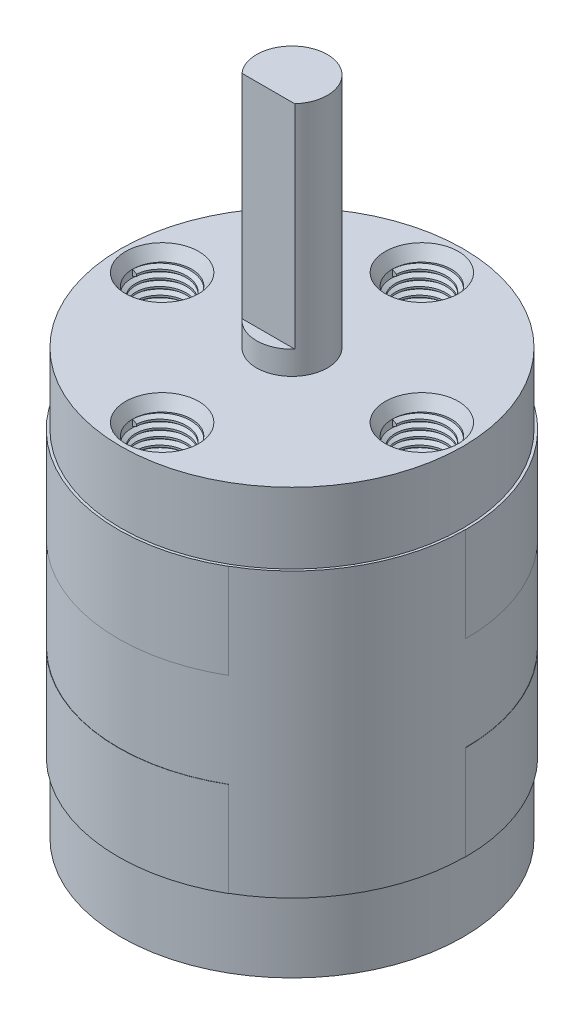
from build123d import *
from build123d.topology import SkipClean

# Parameters (mm, degrees)
SKETCH_1_R               = 7.25
EXTRUDE_1_DEPTH          = 18
SKETCH_2_R               = 1.5
EXTRUDE_2_DEPTH          = 10
CUT_EXTRUDE_START        = -9
CUT_EXTRUDE_1_DEPTH      = 9
SKETCH_4_R               = 1.25
CUT_EXTRUDE_2_DEPTH      = 5
PATTERN_CIRCULAR_1_COUNT = 4
SKETCH_9_W               = 0.1
SKETCH_9_H               = 12
SKETCH_11_W              = 0.01
SKETCH_11_H              = 4
REVOLVE_2_ANGLE          = 300
THREAD_1_PITCH           = 0.3175
THREAD_2_PITCH           = 0.3175
THREAD_3_PITCH           = 0.3175
THREAD_4_PITCH           = 0.3175


with BuildPart() as part:
    # Sketch 1 → 凸台-拉伸1 (new body)
    with BuildSketch(Plane(origin=(0, 0, 0), x_dir=(1, 0, 0), z_dir=(0, 1, 0))):
        with Locations(Location((0, 0, 0), (0, 0, 270))):
            Circle(SKETCH_1_R)
    extrude(amount=EXTRUDE_1_DEPTH)

    # Sketch 2 → 凸台-拉伸2 (add)
    with BuildSketch(Plane(origin=(0, 18, 0), x_dir=(1, 0, 0), z_dir=(0, 1, 0))):
        with Locations(Location((0, 0, 0), (0, 0, 270))):
            Circle(SKETCH_2_R)
    extrude(amount=EXTRUDE_2_DEPTH)

    # Sketch 3 → 切除-拉伸1 (cut)
    with BuildSketch(Plane(origin=(0, 28, 0), x_dir=(1, 0, 0), z_dir=(0, 1, 0)).offset(CUT_EXTRUDE_START)):
        with BuildLine():
            Line((1.118033989, -1), (-1.118033989, -1))
            ThreePointArc((-1.118033989, -1), (0, -1.5), (1.118033989, -1))
        make_face()
    extrude(amount=CUT_EXTRUDE_1_DEPTH, mode=Mode.SUBTRACT)

    # Sketch 4 → 切除-拉伸2 (cut)
    with BuildSketch(Plane(origin=(0, 18, 0), x_dir=(1, 0, 0), z_dir=(0, 1, 0))):
        with Locations(Location((5.5, 0, 0), (0, 0, 270))):
            Circle(SKETCH_4_R)
        with Locations(Location((0, -5.5, 0), (0, 0, 270))):
            Circle(SKETCH_4_R)
        with Locations(Location((-5.5, 0, 0), (0, 0, 270))):
            Circle(SKETCH_4_R)
        with Locations(Location((0, 5.5, 0), (0, 0, 270))):
            Circle(SKETCH_4_R)
    extrude(amount=-CUT_EXTRUDE_2_DEPTH, mode=Mode.SUBTRACT)

    # 草图8 → 切除-旋转1 (revolve, cut)
    with BuildSketch(Plane.XY, mode=Mode.PRIVATE) as cut_revolve_1_sk:
        Polygon((6.75, 18), (7.05, 18), (6.75, 17.5), (5.5, 17.5), (5.5, 18), align=None)
    cut_revolve_1 = revolve(cut_revolve_1_sk.sketch.rotate(Axis((5.5, 18, 0), (0, -1, 0)), 90), axis=Axis((5.5, 18, 0), (0, -1, 0)), mode=Mode.SUBTRACT)

    # 阵列(圆周)1: 切除-旋转1 ×4 about axis
    pattern_circular_1_axis = Axis((0, 0, 0), (0, 1, 0))
    for i in range(1, PATTERN_CIRCULAR_1_COUNT):
        add(cut_revolve_1.rotate(pattern_circular_1_axis, i * 360 / PATTERN_CIRCULAR_1_COUNT), mode=Mode.SUBTRACT)

    # 草图9 → 旋转1 (revolve)
    with BuildSketch(Plane.XY, mode=Mode.PRIVATE) as revolve_1_sk:
        with Locations((7.3, 9)):
            Rectangle(SKETCH_9_W, SKETCH_9_H)
    revolve(revolve_1_sk.sketch.rotate(Axis((0, 0, 0), (0, 1, 0)), 90), axis=Axis((0, 0, 0), (0, 1, 0)))

    # 草图11 → 旋转2 (revolve)
    with BuildSketch(Plane.XY):
        with Locations((7.355, 13)):
            Rectangle(SKETCH_11_W, SKETCH_11_H)
        with Locations((7.355, 5)):
            Rectangle(SKETCH_11_W, SKETCH_11_H)
    revolve(axis=Axis((0, 0, 0), (0, 1, 0)), revolution_arc=REVOLVE_2_ANGLE)

    # 螺纹线1: the profile of Sketch 1 2 profile screwed along a right-hand helix of 15.748031 turns, 6 arcs to a turn; built about Z, then put on its axis
    with SkipClean():  # the faces are left unmerged after this step: merging them gives an invalid solid
        thread_1_z = Axis((0, 0, 0), (0, 0, 1))
        thread_1_corners = [(1.2503, 0, -0.000173205), (1.2503, 0, 0.277985704), (1.078148085, 0, 0.17859375), (1.078148085, 0, 0.09921875)]
        with BuildLine(mode=Mode.PRIVATE) as thread_1_profile:
            Line(thread_1_corners[0], thread_1_corners[1])
            Line(thread_1_corners[1], thread_1_corners[2])
            Line(thread_1_corners[2], thread_1_corners[3])
            Line(thread_1_corners[3], thread_1_corners[0])
        thread_1_cap = Face(thread_1_profile.wire())
        thread_1_turn_angles = [0, 30, 60, 90, 120, 150, 180, 210, 240, 270, 300, 330, 360]
        thread_1_turn_weights = [1, 0.8660254037844387, 1, 0.8660254037844387, 1, 0.8660254037844387, 1, 0.8660254037844387, 1, 0.8660254037844387, 1, 0.8660254037844387, 1]
        thread_1_turn_rails = [Edge.make_bspline([Vector(p[0], p[1], 0).rotate(thread_1_z, thread_1_turn_angles[k]) / thread_1_turn_weights[k] + Vector(0, 0, p[2] + THREAD_1_PITCH * thread_1_turn_angles[k] / 360) for k in range(13)], [0, 0, 0, 1, 1, 2, 2, 3, 3, 4, 4, 5, 5, 6, 6, 6], 2, thread_1_turn_weights) for p in thread_1_corners]
        thread_1_turn_sides = [Face.make_surface_from_curves(thread_1_turn_rails[p[0]], thread_1_turn_rails[p[1]]) for p in [(0, 1), (1, 2), (2, 3), (3, 0)]]
        thread_1_last_angles = [5400, 5430, 5460, 5490, 5520, 5550, 5580, 5610, 5640, 5654.645669291, 5669.291338583]
        thread_1_last_weights = [1, 0.8660254037844387, 1, 0.8660254037844387, 1, 0.8660254037844387, 1, 0.8660254037844387, 1, 0.9675079437748935, 1]
        thread_1_last_rails = [Edge.make_bspline([Vector(p[0], p[1], 0).rotate(thread_1_z, thread_1_last_angles[k]) / thread_1_last_weights[k] + Vector(0, 0, p[2] + THREAD_1_PITCH * thread_1_last_angles[k] / 360) for k in range(11)], [0, 0, 0, 1, 1, 2, 2, 3, 3, 4, 4, 5, 5, 5], 2, thread_1_last_weights) for p in thread_1_corners]
        thread_1_last_sides = [Face.make_surface_from_curves(thread_1_last_rails[p[0]], thread_1_last_rails[p[1]]) for p in [(0, 1), (1, 2), (2, 3), (3, 0)]]
        thread_1 = Plane(origin=(-5.5, 17.5, 0), x_dir=(-1, 0, 0), z_dir=(0, -1, 0)) * Solid(Shell([*[p.moved(Location((0, 0, THREAD_1_PITCH * i))) for i in range(15) for p in thread_1_turn_sides], *thread_1_last_sides, thread_1_cap, thread_1_cap.rotate(thread_1_z, 5669.291338583).moved(Location((0, 0, THREAD_1_PITCH * 5669.291338583 / 360)))]))
        add(thread_1)

    # 螺纹线2: the profile of Sketch 2 2 profile screwed along a right-hand helix of 15.748031 turns, 6 arcs to a turn; built about Z, then put on its axis
    with SkipClean():  # the faces are left unmerged after this step: merging them gives an invalid solid
        thread_2_z = Axis((0, 0, 0), (0, 0, 1))
        thread_2_corners = [(1.2503, 0, -0.000173205), (1.2503, 0, 0.277985704), (1.078148085, 0, 0.17859375), (1.078148085, 0, 0.09921875)]
        with BuildLine(mode=Mode.PRIVATE) as thread_2_profile:
            Line(thread_2_corners[0], thread_2_corners[1])
            Line(thread_2_corners[1], thread_2_corners[2])
            Line(thread_2_corners[2], thread_2_corners[3])
            Line(thread_2_corners[3], thread_2_corners[0])
        thread_2_cap = Face(thread_2_profile.wire())
        thread_2_turn_angles = [0, 30, 60, 90, 120, 150, 180, 210, 240, 270, 300, 330, 360]
        thread_2_turn_weights = [1, 0.8660254037844387, 1, 0.8660254037844387, 1, 0.8660254037844387, 1, 0.8660254037844387, 1, 0.8660254037844387, 1, 0.8660254037844387, 1]
        thread_2_turn_rails = [Edge.make_bspline([Vector(p[0], p[1], 0).rotate(thread_2_z, thread_2_turn_angles[k]) / thread_2_turn_weights[k] + Vector(0, 0, p[2] + THREAD_2_PITCH * thread_2_turn_angles[k] / 360) for k in range(13)], [0, 0, 0, 1, 1, 2, 2, 3, 3, 4, 4, 5, 5, 6, 6, 6], 2, thread_2_turn_weights) for p in thread_2_corners]
        thread_2_turn_sides = [Face.make_surface_from_curves(thread_2_turn_rails[p[0]], thread_2_turn_rails[p[1]]) for p in [(0, 1), (1, 2), (2, 3), (3, 0)]]
        thread_2_last_angles = [5400, 5430, 5460, 5490, 5520, 5550, 5580, 5610, 5640, 5654.645669291, 5669.291338583]
        thread_2_last_weights = [1, 0.8660254037844387, 1, 0.8660254037844387, 1, 0.8660254037844387, 1, 0.8660254037844387, 1, 0.9675079437748935, 1]
        thread_2_last_rails = [Edge.make_bspline([Vector(p[0], p[1], 0).rotate(thread_2_z, thread_2_last_angles[k]) / thread_2_last_weights[k] + Vector(0, 0, p[2] + THREAD_2_PITCH * thread_2_last_angles[k] / 360) for k in range(11)], [0, 0, 0, 1, 1, 2, 2, 3, 3, 4, 4, 5, 5, 5], 2, thread_2_last_weights) for p in thread_2_corners]
        thread_2_last_sides = [Face.make_surface_from_curves(thread_2_last_rails[p[0]], thread_2_last_rails[p[1]]) for p in [(0, 1), (1, 2), (2, 3), (3, 0)]]
        thread_2 = Plane(origin=(0, 17.5, -5.5), x_dir=(-1, 0, 0), z_dir=(0, -1, 0)) * Solid(Shell([*[p.moved(Location((0, 0, THREAD_2_PITCH * i))) for i in range(15) for p in thread_2_turn_sides], *thread_2_last_sides, thread_2_cap, thread_2_cap.rotate(thread_2_z, 5669.291338583).moved(Location((0, 0, THREAD_2_PITCH * 5669.291338583 / 360)))]))
        add(thread_2)

    # 螺纹线3: the profile of Sketch 3 2 profile screwed along a right-hand helix of 15.748031 turns, 6 arcs to a turn; built about Z, then put on its axis
    with SkipClean():  # the faces are left unmerged after this step: merging them gives an invalid solid
        thread_3_z = Axis((0, 0, 0), (0, 0, 1))
        thread_3_corners = [(1.2503, 0, -0.000173205), (1.2503, 0, 0.277985704), (1.078148085, 0, 0.17859375), (1.078148085, 0, 0.09921875)]
        with BuildLine(mode=Mode.PRIVATE) as thread_3_profile:
            Line(thread_3_corners[0], thread_3_corners[1])
            Line(thread_3_corners[1], thread_3_corners[2])
            Line(thread_3_corners[2], thread_3_corners[3])
            Line(thread_3_corners[3], thread_3_corners[0])
        thread_3_cap = Face(thread_3_profile.wire())
        thread_3_turn_angles = [0, 30, 60, 90, 120, 150, 180, 210, 240, 270, 300, 330, 360]
        thread_3_turn_weights = [1, 0.8660254037844387, 1, 0.8660254037844387, 1, 0.8660254037844387, 1, 0.8660254037844387, 1, 0.8660254037844387, 1, 0.8660254037844387, 1]
        thread_3_turn_rails = [Edge.make_bspline([Vector(p[0], p[1], 0).rotate(thread_3_z, thread_3_turn_angles[k]) / thread_3_turn_weights[k] + Vector(0, 0, p[2] + THREAD_3_PITCH * thread_3_turn_angles[k] / 360) for k in range(13)], [0, 0, 0, 1, 1, 2, 2, 3, 3, 4, 4, 5, 5, 6, 6, 6], 2, thread_3_turn_weights) for p in thread_3_corners]
        thread_3_turn_sides = [Face.make_surface_from_curves(thread_3_turn_rails[p[0]], thread_3_turn_rails[p[1]]) for p in [(0, 1), (1, 2), (2, 3), (3, 0)]]
        thread_3_last_angles = [5400, 5430, 5460, 5490, 5520, 5550, 5580, 5610, 5640, 5654.645669291, 5669.291338583]
        thread_3_last_weights = [1, 0.8660254037844387, 1, 0.8660254037844387, 1, 0.8660254037844387, 1, 0.8660254037844387, 1, 0.9675079437748935, 1]
        thread_3_last_rails = [Edge.make_bspline([Vector(p[0], p[1], 0).rotate(thread_3_z, thread_3_last_angles[k]) / thread_3_last_weights[k] + Vector(0, 0, p[2] + THREAD_3_PITCH * thread_3_last_angles[k] / 360) for k in range(11)], [0, 0, 0, 1, 1, 2, 2, 3, 3, 4, 4, 5, 5, 5], 2, thread_3_last_weights) for p in thread_3_corners]
        thread_3_last_sides = [Face.make_surface_from_curves(thread_3_last_rails[p[0]], thread_3_last_rails[p[1]]) for p in [(0, 1), (1, 2), (2, 3), (3, 0)]]
        thread_3 = Plane(origin=(5.5, 17.5, 0), x_dir=(-1, 0, 0), z_dir=(0, -1, 0)) * Solid(Shell([*[p.moved(Location((0, 0, THREAD_3_PITCH * i))) for i in range(15) for p in thread_3_turn_sides], *thread_3_last_sides, thread_3_cap, thread_3_cap.rotate(thread_3_z, 5669.291338583).moved(Location((0, 0, THREAD_3_PITCH * 5669.291338583 / 360)))]))
        add(thread_3)

    # 螺纹线4: the profile of Sketch 4 2 profile screwed along a right-hand helix of 15.748031 turns, 6 arcs to a turn; built about Z, then put on its axis
    with SkipClean():  # the faces are left unmerged after this step: merging them gives an invalid solid
        thread_4_z = Axis((0, 0, 0), (0, 0, 1))
        thread_4_corners = [(1.2503, 0, -0.000173205), (1.2503, 0, 0.277985704), (1.078148085, 0, 0.17859375), (1.078148085, 0, 0.09921875)]
        with BuildLine(mode=Mode.PRIVATE) as thread_4_profile:
            Line(thread_4_corners[0], thread_4_corners[1])
            Line(thread_4_corners[1], thread_4_corners[2])
            Line(thread_4_corners[2], thread_4_corners[3])
            Line(thread_4_corners[3], thread_4_corners[0])
        thread_4_cap = Face(thread_4_profile.wire())
        thread_4_turn_angles = [0, 30, 60, 90, 120, 150, 180, 210, 240, 270, 300, 330, 360]
        thread_4_turn_weights = [1, 0.8660254037844387, 1, 0.8660254037844387, 1, 0.8660254037844387, 1, 0.8660254037844387, 1, 0.8660254037844387, 1, 0.8660254037844387, 1]
        thread_4_turn_rails = [Edge.make_bspline([Vector(p[0], p[1], 0).rotate(thread_4_z, thread_4_turn_angles[k]) / thread_4_turn_weights[k] + Vector(0, 0, p[2] + THREAD_4_PITCH * thread_4_turn_angles[k] / 360) for k in range(13)], [0, 0, 0, 1, 1, 2, 2, 3, 3, 4, 4, 5, 5, 6, 6, 6], 2, thread_4_turn_weights) for p in thread_4_corners]
        thread_4_turn_sides = [Face.make_surface_from_curves(thread_4_turn_rails[p[0]], thread_4_turn_rails[p[1]]) for p in [(0, 1), (1, 2), (2, 3), (3, 0)]]
        thread_4_last_angles = [5400, 5430, 5460, 5490, 5520, 5550, 5580, 5610, 5640, 5654.645669291, 5669.291338583]
        thread_4_last_weights = [1, 0.8660254037844387, 1, 0.8660254037844387, 1, 0.8660254037844387, 1, 0.8660254037844387, 1, 0.9675079437748935, 1]
        thread_4_last_rails = [Edge.make_bspline([Vector(p[0], p[1], 0).rotate(thread_4_z, thread_4_last_angles[k]) / thread_4_last_weights[k] + Vector(0, 0, p[2] + THREAD_4_PITCH * thread_4_last_angles[k] / 360) for k in range(11)], [0, 0, 0, 1, 1, 2, 2, 3, 3, 4, 4, 5, 5, 5], 2, thread_4_last_weights) for p in thread_4_corners]
        thread_4_last_sides = [Face.make_surface_from_curves(thread_4_last_rails[p[0]], thread_4_last_rails[p[1]]) for p in [(0, 1), (1, 2), (2, 3), (3, 0)]]
        thread_4 = Plane(origin=(0, 17.5, 5.5), x_dir=(-1, 0, 0), z_dir=(0, -1, 0)) * Solid(Shell([*[p.moved(Location((0, 0, THREAD_4_PITCH * i))) for i in range(15) for p in thread_4_turn_sides], *thread_4_last_sides, thread_4_cap, thread_4_cap.rotate(thread_4_z, 5669.291338583).moved(Location((0, 0, THREAD_4_PITCH * 5669.291338583 / 360)))]))
        add(thread_4)


solid = part.part
